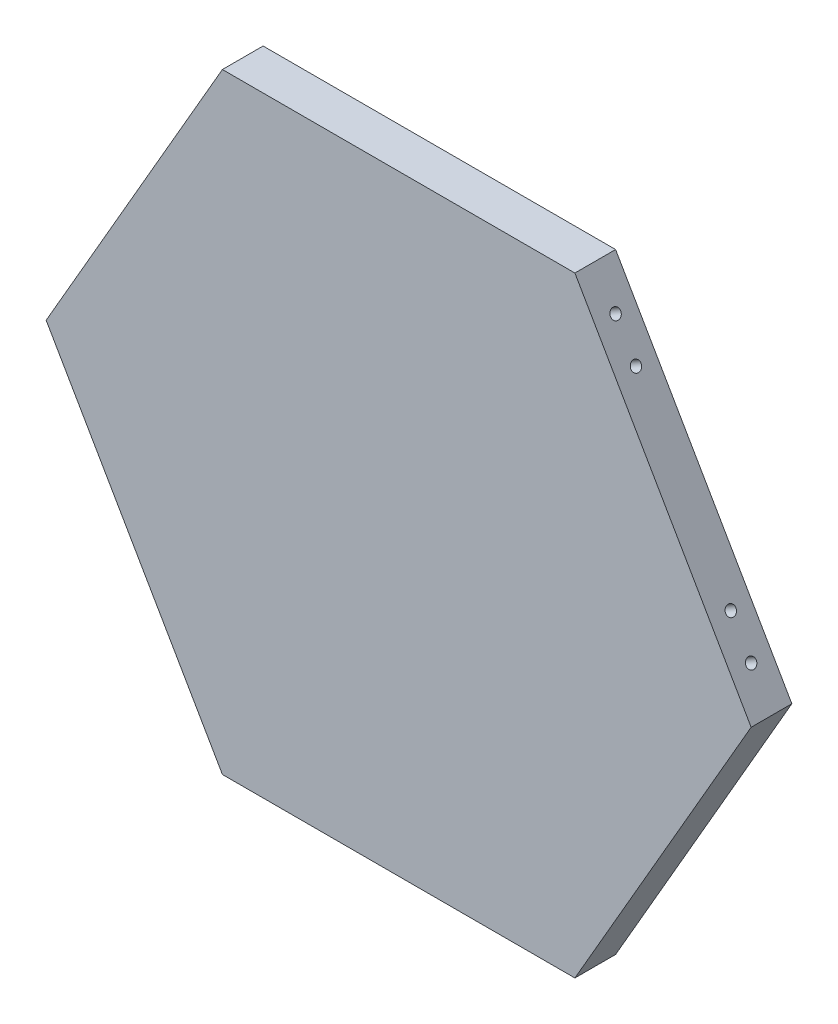
from build123d import *

# Parameters (mm, degrees)
BOSS_EXTRUDE1_DEPTH = 10
SKETCH2_R           = 1.25
CUT_EXTRUDE1_DEPTH  = 5
CIRPATTERN1_COUNT   = 3


with BuildPart() as part:
    # Sketch1 → Boss-Extrude1 (new body)
    with BuildSketch(Plane.XY):
        Polygon((43.301270189, -75), (86.602540378, 0), (43.301270189, 75), (-43.301270189, 75), (-86.602540378, 0), (-43.301270189, -75), align=None)
    extrude(amount=BOSS_EXTRUDE1_DEPTH)

    # Sketch2 → Cut-Extrude1 (cut)
    with BuildSketch(Plane.XZ.offset(75)):
        with Locations((-33.301270189, 5)):
            Circle(SKETCH2_R)
        with Locations((-23.301270189, 5)):
            Circle(SKETCH2_R)
        with Locations((33.301270189, 5)):
            Circle(SKETCH2_R)
        with Locations((23.301270189, 5)):
            Circle(SKETCH2_R)
    cut_extrude1 = extrude(amount=-CUT_EXTRUDE1_DEPTH, mode=Mode.SUBTRACT)

    # CirPattern1: Cut-Extrude1 ×3 about axis
    cirpattern1_axis = Axis((0, 0, 10), (0, 0, 1))
    for i in range(1, CIRPATTERN1_COUNT):
        add(cut_extrude1.rotate(cirpattern1_axis, i * 360 / CIRPATTERN1_COUNT), mode=Mode.SUBTRACT)


solid = part.part
